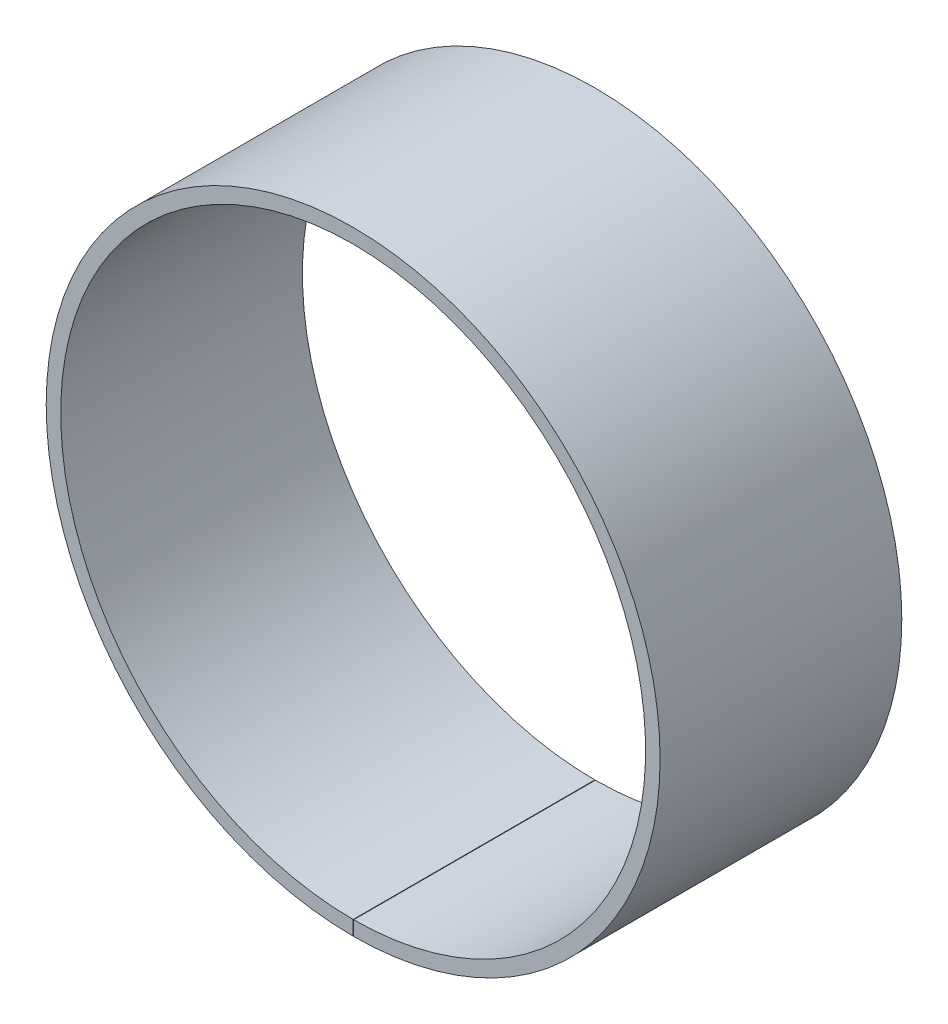
from build123d import *

# Parameters (mm, degrees)
BASE_FLANGE1_DEPTH = 50


# Sheet-metal steps are written as plain solids
with BuildPart() as part:
    # Sketch2 → Base-Flange1 (new body)
    with BuildSketch(Plane.XY):
        with BuildLine():
            ThreePointArc((0, -63.5), (-0.055414197, 63.499975821), (0.110828351, -63.499903284))
            Line((0.110828351, -63.499903284), (0.105592366, -60.499907853))
            ThreePointArc((0.105592366, -60.499907853), (-0.052796203, 60.499976963), (0, -60.5))
            Line((0, -60.5), (0, -63.5))
        make_face()
    extrude(amount=BASE_FLANGE1_DEPTH)


solid = part.part
